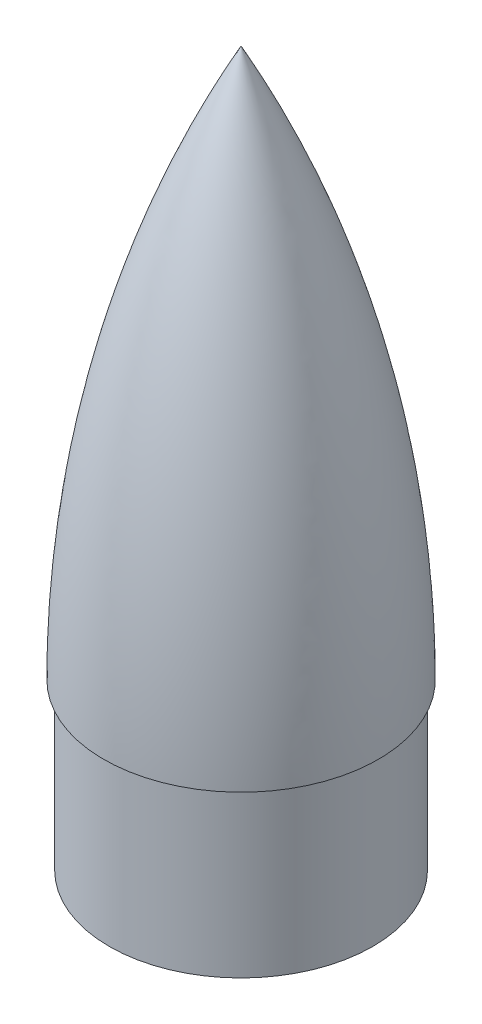
from build123d import *


# Read off the part's stored shape, not the designer's step: Оболочка2
with BuildPart() as part:
    # Эскиз1 → Повернуть1 (revolve)
    with BuildSketch(Plane.XY):
        with BuildLine():
            Line((-25, 0), (-24, 0))
            Line((-24, 0), (-24, -30))
            Line((-24, -30), (0, -30))
            Line((0, -30), (0, 100))
            ThreePointArc((0, 100), (-18.655281281, 51.53882032), (-25, 0))
        make_face()
    revolve(axis=Axis((0, 100, 0), (0, -1, 0)))

    # Оболочка2 outline → Оболочка2 (revolve, cut)
    with BuildSketch(Plane.XY):
        with BuildLine():
            Line((22.8, 1.2), (23.796592495, 1.2))
            add(Edge.make_bspline(
                [(23.796592495, 1.2), (23.774700822, 5.054696622), (23.66484789, 8.919351817), (23.46610258, 12.789995742), (23.177885422, 16.662560502), (21.234465167, 36.567263257), (18.129287608, 52.567740755), (13.472093819, 68.223289776), (7.363195976, 83.252986427), (0, 97.424021678)],
                knots=[0.00567916, 0.00567916, 0.00567916, 0.00567916, 0.00567916, 0.00567916, 0.097752258, 0.097752258, 0.097752258, 0.097752258, 0.47920027, 0.47920027, 0.47920027, 0.47920027, 0.47920027, 0.47920027], degree=5, weights=[1, 1, 0.999999603, 0.999999596, 1, 1, 0.999867432, 0.999869751, 1, 1]))
            Line((0, 97.424021678), (0, -30))
            Line((0, -30), (22.8, -30))
            Line((22.8, -30), (22.8, 1.2))
        make_face()
    revolve(axis=Axis((0, 0, 0), (0, 1, 0)), mode=Mode.SUBTRACT)


solid = part.part
